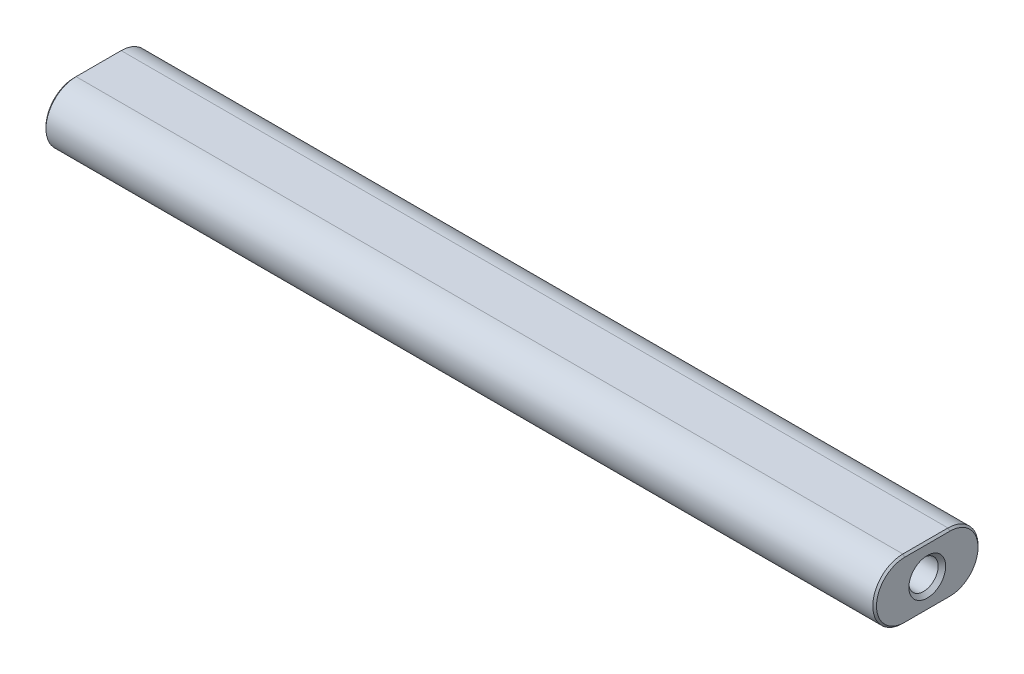
from build123d import *

# Parameters (mm, degrees)
BOSS_EXTRUDE1_DEPTH = 55.25
SKETCH2_R           = 1.95
CUT_EXTRUDE1_DEPTH  = 8
CHAMFER1_SIZE       = 0.5
CHAMFER2_SIZE       = 0.25


with BuildPart() as part:
    # Sketch1 → Boss-Extrude1 (new, symmetric)
    with BuildSketch(Plane(origin=(0, 0, 0), x_dir=(0, 0, -1), z_dir=(1, 0, 0))):
        with BuildLine():
            Line((-3, 4), (3, 4))
            ThreePointArc((3, 4), (7, 0), (3, -4))
            Line((3, -4), (-3, -4))
            ThreePointArc((-3, -4), (-7, 0), (-3, 4))
        make_face()
    extrude(amount=BOSS_EXTRUDE1_DEPTH, both=True)

    # Sketch2 → Cut-Extrude1 (cut)
    with BuildSketch(Plane(origin=(55.25, 0, 0), x_dir=(0, 0, -1), z_dir=(1, 0, 0))):
        Circle(SKETCH2_R)
    cut_extrude1 = extrude(amount=-CUT_EXTRUDE1_DEPTH, mode=Mode.SUBTRACT)

    # Mirror1: Cut-Extrude1 across plane
    add(cut_extrude1.mirror(Plane(origin=(0, 0, 0), x_dir=(0, 0, 1), z_dir=(1, 0, 0))), mode=Mode.SUBTRACT)

    # Chamfer1
    chamfer1_edges = [part.edges().sort_by_distance(p)[0] for p in [
        (-55.25, 0, 1.95),
        (55.25, 0, 1.95),
    ]]
    chamfer(chamfer1_edges, length=CHAMFER1_SIZE)

    # Chamfer2
    chamfer2_edges = [part.edges().sort_by_distance(p)[0] for p in [
        (55.25, -4, 0),
        (55.25, 0, -7),
        (55.25, 0, 7),
        (55.25, 4, 0),
        (-55.25, -4, 0),
        (-55.25, 0, -7),
        (-55.25, 0, 7),
        (-55.25, 4, 0),
    ]]
    chamfer(chamfer2_edges, length=CHAMFER2_SIZE)


solid = part.part
